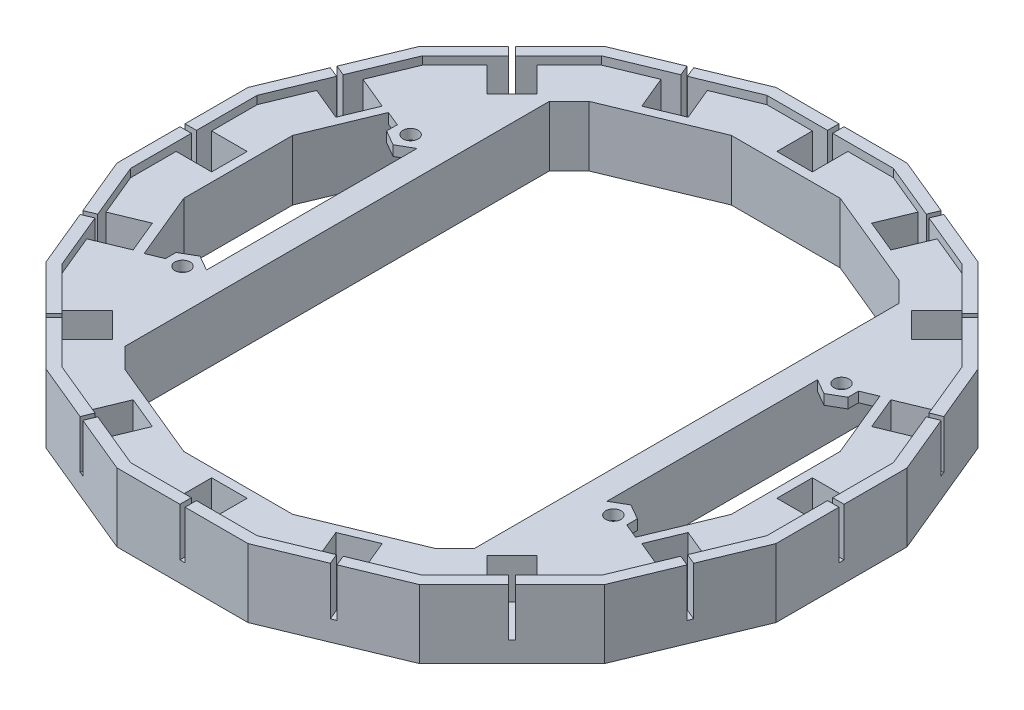
from build123d import *

# Parameters (mm, degrees)
BOSS_EXTRUDE1_DEPTH = 13.5
CUT_EXTRUDE1_DEPTH  = 1.6
CUT_EXTRUDE2_DEPTH  = 9.5
SKETCH5_R           = 1.5
BOSS_EXTRUDE2_DEPTH = 2
CHAMFER1_SIZE       = 8
BOSS_EXTRUDE3_DEPTH = 11.9


with BuildPart() as part:
    # Sketch1 → Boss-Extrude1 (new body)
    with BuildSketch(Plane(origin=(0, 0, 0), x_dir=(1, 0, 0), z_dir=(0, 1, 0))):
        Polygon((55.104339226, 36.819542328), (36.819542328, 55.104339226), (12.92930388, 65), (-12.92930388, 65), (-36.819542328, 55.104339226), (-55.104339226, 36.819542328), (-65, 12.92930388), (-65, -12.92930388), (-55.104339226, -36.819542328), (-36.819542328, -55.104339226), (-12.92930388, -65), (12.92930388, -65), (36.819542328, -55.104339226), (55.104339226, -36.819542328), (65, -12.92930388), (65, 12.92930388), align=None)
        Polygon((10.741267839, 54), (-10.741267839, 54), (-30.588542857, 45.778989511), (-45.778989511, 30.588542857), (-54, 10.741267839), (-54, -10.741267839), (-45.778989511, -30.588542857), (-30.588542857, -45.778989511), (-10.741267839, -54), (10.741267839, -54), (30.588542857, -45.778989511), (45.778989511, -30.588542857), (54, -10.741267839), (54, 10.741267839), (45.778989511, 30.588542857), (30.588542857, 45.778989511), align=None, mode=Mode.SUBTRACT)
    extrude(amount=BOSS_EXTRUDE1_DEPTH)

    # Sketch2 → Cut-Extrude1 (cut)
    with BuildSketch(Plane(origin=(0, 13.5, 0), x_dir=(1, 0, 0), z_dir=(0, 1, 0))):
        Polygon((35.545019709, 53.19688133), (12.481751053, 62.75), (-12.481751053, 62.75), (-35.545019709, 53.19688133), (-53.19688133, 35.545019709), (-62.75, 12.481751053), (-62.75, -12.481751053), (-53.19688133, -35.545019709), (-35.545019709, -53.19688133), (-12.481751053, -62.75), (12.481751053, -62.75), (35.545019709, -53.19688133), (53.19688133, -35.545019709), (62.75, -12.481751053), (62.75, 12.481751053), (53.19688133, 35.545019709), align=None)
    extrude(amount=-CUT_EXTRUDE1_DEPTH, mode=Mode.SUBTRACT)

    # Sketch3 → Cut-Extrude2 (cut)
    with BuildSketch(Plane(origin=(0, 13.5, 0), x_dir=(1, 0, 0), z_dir=(0, 1, 0))):
        Polygon((-3.5, 62.75), (-0.5, 62.75), (-0.5, 65), (0.5, 65), (0.5, 62.75), (3.5, 62.75), (3.5, 55.75), (-3.5, 55.75), align=None)
        Polygon((20.779807017, 59.312832678), (23.551445615, 58.164782381), (24.412483337, 60.243511329), (25.33636287, 59.860827897), (24.475325147, 57.782098949), (27.246963745, 56.634048652), (24.568179718, 50.166891924), (18.101022991, 52.845675951), align=None)
        Polygon((41.896076785, 46.845824254), (44.017397129, 44.72450391), (45.608387387, 46.315494168), (46.315494168, 45.608387387), (44.72450391, 44.017397129), (46.845824254, 41.896076785), (41.896076785, 36.946329317), (36.946329317, 41.896076785), align=None)
        Polygon((56.634048652, 27.246963745), (57.782098949, 24.475325147), (59.860827897, 25.33636287), (60.243511329, 24.412483337), (58.164782381, 23.551445615), (59.312832678, 20.779807017), (52.845675951, 18.101022991), (50.166891924, 24.568179718), align=None)
        Polygon((62.75, 3.5), (62.75, 0.5), (65, 0.5), (65, -0.5), (62.75, -0.5), (62.75, -3.5), (55.75, -3.5), (55.75, 3.5), align=None)
        Polygon((59.312832678, -20.779807017), (58.164782381, -23.551445615), (60.243511329, -24.412483337), (59.860827897, -25.33636287), (57.782098949, -24.475325147), (56.634048652, -27.246963745), (50.166891924, -24.568179718), (52.845675951, -18.101022991), align=None)
        Polygon((46.845824254, -41.896076785), (44.72450391, -44.017397129), (46.315494168, -45.608387387), (45.608387387, -46.315494168), (44.017397129, -44.72450391), (41.896076785, -46.845824254), (36.946329317, -41.896076785), (41.896076785, -36.946329317), align=None)
        Polygon((27.246963745, -56.634048652), (24.475325147, -57.782098949), (25.33636287, -59.860827897), (24.412483337, -60.243511329), (23.551445615, -58.164782381), (20.779807017, -59.312832678), (18.101022991, -52.845675951), (24.568179718, -50.166891924), align=None)
        Polygon((3.5, -62.75), (0.5, -62.75), (0.5, -65), (-0.5, -65), (-0.5, -62.75), (-3.5, -62.75), (-3.5, -55.75), (3.5, -55.75), align=None)
        Polygon((-20.779807017, -59.312832678), (-23.551445615, -58.164782381), (-24.412483337, -60.243511329), (-25.33636287, -59.860827897), (-24.475325147, -57.782098949), (-27.246963745, -56.634048652), (-24.568179718, -50.166891924), (-18.101022991, -52.845675951), align=None)
        Polygon((-41.896076785, -46.845824254), (-44.017397129, -44.72450391), (-45.608387387, -46.315494168), (-46.315494168, -45.608387387), (-44.72450391, -44.017397129), (-46.845824254, -41.896076785), (-41.896076785, -36.946329317), (-36.946329317, -41.896076785), align=None)
        Polygon((-56.634048652, -27.246963745), (-57.782098949, -24.475325147), (-59.860827897, -25.33636287), (-60.243511329, -24.412483337), (-58.164782381, -23.551445615), (-59.312832678, -20.779807017), (-52.845675951, -18.101022991), (-50.166891924, -24.568179718), align=None)
        Polygon((-62.75, -3.5), (-62.75, -0.5), (-65, -0.5), (-65, 0.5), (-62.75, 0.5), (-62.75, 3.5), (-55.75, 3.5), (-55.75, -3.5), align=None)
        Polygon((-59.312832678, 20.779807017), (-58.164782381, 23.551445615), (-60.243511329, 24.412483337), (-59.860827897, 25.33636287), (-57.782098949, 24.475325147), (-56.634048652, 27.246963745), (-50.166891924, 24.568179718), (-52.845675951, 18.101022991), align=None)
        Polygon((-46.845824254, 41.896076785), (-44.72450391, 44.017397129), (-46.315494168, 45.608387387), (-45.608387387, 46.315494168), (-44.017397129, 44.72450391), (-41.896076785, 46.845824254), (-36.946329317, 41.896076785), (-41.896076785, 36.946329317), align=None)
        Polygon((-27.246963745, 56.634048652), (-24.475325147, 57.782098949), (-25.33636287, 59.860827897), (-24.412483337, 60.243511329), (-23.551445615, 58.164782381), (-20.779807017, 59.312832678), (-18.101022991, 52.845675951), (-24.568179718, 50.166891924), align=None)
    extrude(amount=-CUT_EXTRUDE2_DEPTH, mode=Mode.SUBTRACT)

    # Sketch5 → Boss-Extrude2 (add)
    # profile 1 of 4: a face of its own
    with BuildSketch(Plane(origin=(0, 11.9, 0), x_dir=(1, 0, 0), z_dir=(0, 1, 0))):
        Polygon((-39.5, 24.232050808), (-39.5, 36.867532368), (-45.5, 30.867532368), (-45.5, 24.232050808), (-45.5, 20.767949192), (-42.5, 19.035898385), (-39.5, 20.767949192), align=None)
        with Locations(Location((-42.5, 22.5, 0), (0, 0, 270))):
            Circle(SKETCH5_R, mode=Mode.SUBTRACT)
    # profile 2 of 4: a face of its own
    with BuildSketch(Plane(origin=(0, 11.9, 0), x_dir=(1, 0, 0), z_dir=(0, 1, 0))):
        Polygon((-45.5, -24.232050808), (-45.5, -30.867532368), (-39.5, -36.867532368), (-39.5, -24.232050808), (-39.5, -20.767949192), (-42.5, -19.035898385), (-45.5, -20.767949192), align=None)
        with Locations(Location((-42.5, -22.5, 0), (0, 0, 270))):
            Circle(SKETCH5_R, mode=Mode.SUBTRACT)
    # profile 3 of 4: a face of its own
    with BuildSketch(Plane(origin=(0, 11.9, 0), x_dir=(1, 0, 0), z_dir=(0, 1, 0))):
        Polygon((45.5, -24.232050808), (45.5, -20.767949192), (42.5, -19.035898385), (39.5, -20.767949192), (39.5, -24.232050808), (39.5, -36.867532368), (45.5, -30.867532368), align=None)
        with Locations(Location((42.5, -22.5, 0), (0, 0, 270))):
            Circle(SKETCH5_R, mode=Mode.SUBTRACT)
    # profile 4 of 4: a face of its own
    with BuildSketch(Plane(origin=(0, 11.9, 0), x_dir=(1, 0, 0), z_dir=(0, 1, 0))):
        Polygon((45.5, 24.232050808), (45.5, 30.867532368), (39.5, 36.867532368), (39.5, 24.232050808), (39.5, 20.767949192), (42.5, 19.035898385), (45.5, 20.767949192), align=None)
        with Locations(Location((42.5, 22.5, 0), (0, 0, 270))):
            Circle(SKETCH5_R, mode=Mode.SUBTRACT)
    extrude(amount=-BOSS_EXTRUDE2_DEPTH)

    # Chamfer1
    # the kernel refuses this chamfer: 8 mm, written as the material it adds along each edge
    with BuildSketch(Plane(origin=(45.5, 11.9, -30.867532368), x_dir=(0.7323591110720671, 0, 0.6809185945689336), z_dir=(0, -1, 0)), Plane(origin=(-45.5, 11.9, 30.867532368), x_dir=(-0.7323591110720654, 0, -0.6809185945689354), z_dir=(0, -1, 0))) as chamfer1_piece_1:
        Polygon((CHAMFER1_SIZE * 0.999338249359, CHAMFER1_SIZE * 0.0363739380471), (CHAMFER1_SIZE * 0.680918594569, CHAMFER1_SIZE * 0.732359111072), (0, 0), align=None)
    extrude(amount=2)
    with BuildSketch(Plane(origin=(45.5, 11.9, 30.867532368), x_dir=(0.7323591110720631, 0, -0.680918594568938), z_dir=(0, -1, 0)), Plane(origin=(-45.5, 11.9, -30.867532368), x_dir=(-0.732359111072063, 0, 0.6809185945689378), z_dir=(0, -1, 0))) as chamfer1_piece_2:
        Polygon((CHAMFER1_SIZE * 0.999338249359, -CHAMFER1_SIZE * 0.0363739380471), (CHAMFER1_SIZE * 0.680918594569, -CHAMFER1_SIZE * 0.732359111072), (0, 0), align=None)
    extrude(amount=2)

    # Sketch6 → Boss-Extrude3 (add)
    with BuildSketch(Plane.XZ):
        Polygon((-39.5, 36.867532368), (-34.5, 41.867532368), (-34.5, -41.867532368), (-39.5, -36.867532368), align=None)
        Polygon((39.5, 36.867532368), (39.5, -36.867532368), (34.5, -41.867532368), (34.5, 41.867532368), align=None)
    extrude(amount=-BOSS_EXTRUDE3_DEPTH)


solid = part.part
